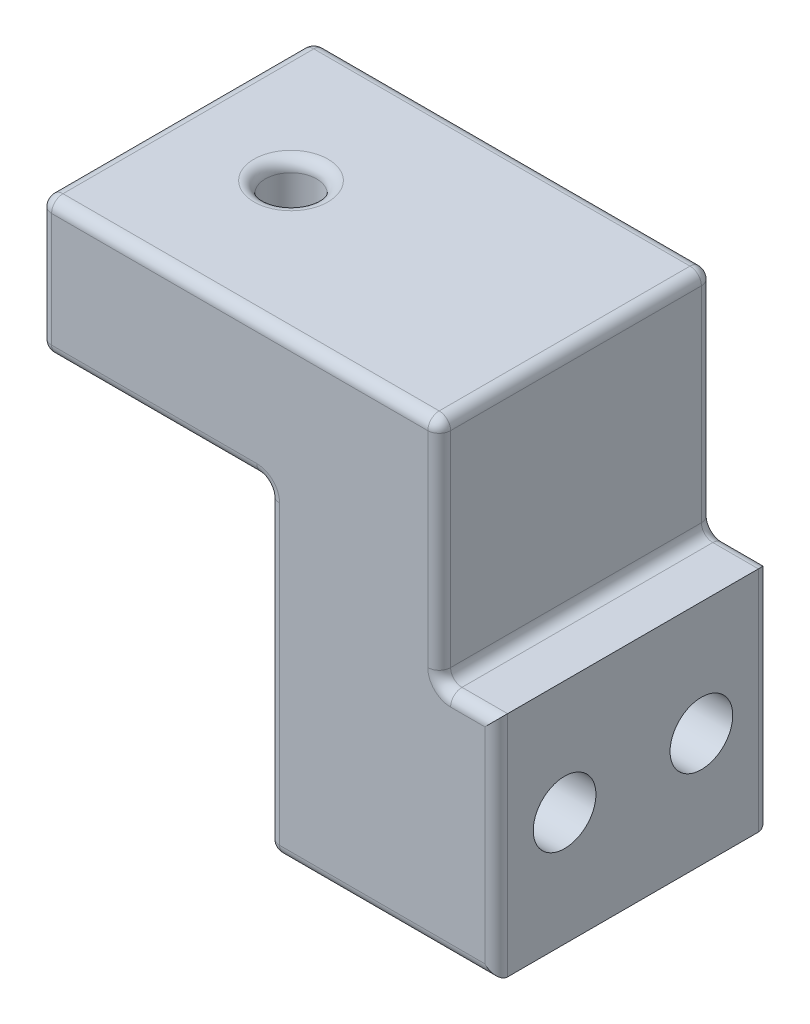
from build123d import *

# Parameters (mm, degrees)
SKETCH4_W           = 40
SKETCH4_H           = 24
BOSS_EXTRUDE2_DEPTH = 40
SKETCH6_W           = 5
SKETCH6_H           = 20
SKETCH6_W_2         = 20
SKETCH6_H_2         = 28
CUT_EXTRUDE1_DEPTH  = 62.449165983
SKETCH7_R           = 2.25
CUT_EXTRUDE2_DEPTH  = 55.405882035
SKETCH10_R          = 2.75
CUT_EXTRUDE4_DEPTH  = 51.754310162
SKETCH12_R          = 4.5
CUT_EXTRUDE5_DEPTH  = 8
FILLET1_R           = 1
CUT_EXTRUDE7_DEPTH  = 5


with BuildPart() as part:
    # Sketch4 → Boss-Extrude2 (new body)
    with BuildSketch(Plane(origin=(0, 0, 0), x_dir=(1, 0, 0), z_dir=(0, 1, 0))):
        with Locations((20, 12)):
            Rectangle(SKETCH4_W, SKETCH4_H)
    extrude(amount=BOSS_EXTRUDE2_DEPTH)

    # Sketch6 → Cut-Extrude1 (cut, through all)
    with BuildSketch(Plane.XY):
        with Locations((37.5, 30)):
            Rectangle(SKETCH6_W, SKETCH6_H)
        with Locations((10, 14)):
            Rectangle(SKETCH6_W_2, SKETCH6_H_2)
    extrude(amount=-CUT_EXTRUDE1_DEPTH, mode=Mode.SUBTRACT)

    # Sketch7 → Cut-Extrude2 (cut, through all)
    with BuildSketch(Plane(origin=(0, 28, 0), x_dir=(-1, 0, 0), z_dir=(0, -1, 0))):
        with Locations(Location((-10, 12, 0), (0, 0, 90))):
            Circle(SKETCH7_R)
    extrude(amount=-CUT_EXTRUDE2_DEPTH, mode=Mode.SUBTRACT)

    # Sketch10 → Cut-Extrude4 (cut, through all)
    with BuildSketch(Plane.ZY.offset(-20)):
        with Locations((-18, 10)):
            Circle(SKETCH10_R)
        with Locations((-6, 10)):
            Circle(SKETCH10_R)
    extrude(amount=-CUT_EXTRUDE4_DEPTH, mode=Mode.SUBTRACT)

    # Sketch12 → Cut-Extrude5 (cut)
    with BuildSketch(Plane.ZY.offset(-20)):
        with Locations((-18, 10)):
            Circle(SKETCH12_R)
        with Locations((-6, 10)):
            Circle(SKETCH12_R)
    extrude(amount=-CUT_EXTRUDE5_DEPTH, mode=Mode.SUBTRACT)

    # Fillet1
    # the kernel refuses this fillet: 1 mm, written as the material it adds along each edge
    with BuildSketch(Plane(origin=(35, 20, 0), x_dir=(1, 0, 0), z_dir=(0, 0, -1)), Plane(origin=(20, 28, 0), x_dir=(-1, 0, 0), z_dir=(0, 0, -1))) as fillet1_piece_1:
        with BuildLine():
            CenterArc((FILLET1_R, -FILLET1_R), FILLET1_R, 90, 90)
            Line((0, -FILLET1_R), (0, 0))
            Line((0, 0), (FILLET1_R, 0))
        make_face()
    extrude(amount=24)
    # the kernel refuses this fillet: 1 mm, written as the material it takes off along each edge
    with BuildSketch(Plane(origin=(21, 1, -1), x_dir=(-1, 0, 0), z_dir=(0, 0, 1))) as fillet1_2_piece_1_section:
        Polygon((0, 0), (FILLET1_R, 0), (FILLET1_R, FILLET1_R), (0, FILLET1_R), align=None)
    fillet1_2_piece_1 = extrude(amount=FILLET1_R, mode=Mode.PRIVATE)
    fillet1_2_piece_1 = fillet1_2_piece_1 - Plane(origin=(21, 1, -1), x_dir=(0.7071067811865475, 0.7071067811865475, 0), z_dir=(0, 0, 1)) * Sphere(FILLET1_R, mode=Mode.PRIVATE)
    add(fillet1_2_piece_1, mode=Mode.SUBTRACT)
    with BuildSketch(Plane(origin=(34, 39, -23), x_dir=(1, 0, 0), z_dir=(0, 0, -1))) as fillet1_2_piece_2_section:
        Polygon((0, 0), (FILLET1_R, 0), (FILLET1_R, -FILLET1_R), (0, -FILLET1_R), align=None)
    fillet1_2_piece_2 = extrude(amount=FILLET1_R, mode=Mode.PRIVATE)
    fillet1_2_piece_2 = fillet1_2_piece_2 - Plane(origin=(34, 39, -23), x_dir=(-0.7071067811865474, -0.7071067811865477, 0), z_dir=(0, 0, -1)) * Sphere(FILLET1_R, mode=Mode.PRIVATE)
    add(fillet1_2_piece_2, mode=Mode.SUBTRACT)
    with BuildSketch(Plane(origin=(1, 39, -23), x_dir=(0, 0, -1), z_dir=(-1, 0, 0))) as fillet1_2_piece_3_section:
        Polygon((0, 0), (FILLET1_R, 0), (FILLET1_R, -FILLET1_R), (0, -FILLET1_R), align=None)
    fillet1_2_piece_3 = extrude(amount=FILLET1_R, mode=Mode.PRIVATE)
    fillet1_2_piece_3 = fillet1_2_piece_3 - Plane(origin=(1, 39, -23), x_dir=(0, -0.7071067811865475, 0.7071067811865475), z_dir=(-1, 0, 0)) * Sphere(FILLET1_R, mode=Mode.PRIVATE)
    add(fillet1_2_piece_3, mode=Mode.SUBTRACT)
    with BuildSketch(Plane(origin=(34, 39, -1), x_dir=(1, 0, 0), z_dir=(0, 0, 1))) as fillet1_2_piece_4_section:
        Polygon((0, 0), (FILLET1_R, 0), (FILLET1_R, FILLET1_R), (0, FILLET1_R), align=None)
    fillet1_2_piece_4 = extrude(amount=FILLET1_R, mode=Mode.PRIVATE)
    fillet1_2_piece_4 = fillet1_2_piece_4 - Plane(origin=(34, 39, -1), x_dir=(-0.7071067811865474, -0.7071067811865477, 0), z_dir=(0, 0, 1)) * Sphere(FILLET1_R, mode=Mode.PRIVATE)
    add(fillet1_2_piece_4, mode=Mode.SUBTRACT)
    with BuildSketch(Plane(origin=(21, 1, -23), x_dir=(-1, 0, 0), z_dir=(0, -1, 0))) as fillet1_2_piece_5_section:
        Polygon((0, 0), (FILLET1_R, 0), (FILLET1_R, FILLET1_R), (0, FILLET1_R), align=None)
    fillet1_2_piece_5 = extrude(amount=FILLET1_R, mode=Mode.PRIVATE)
    fillet1_2_piece_5 = fillet1_2_piece_5 - Plane(origin=(21, 1, -23), x_dir=(0.7071067811865475, 0, 0.7071067811865475), z_dir=(0, -1, 0)) * Sphere(FILLET1_R, mode=Mode.PRIVATE)
    add(fillet1_2_piece_5, mode=Mode.SUBTRACT)
    with BuildSketch(Plane(origin=(1, 29, -23), x_dir=(0, -1, 0), z_dir=(-1, 0, 0))) as fillet1_2_piece_6_section:
        Polygon((0, 0), (FILLET1_R, 0), (FILLET1_R, -FILLET1_R), (0, -FILLET1_R), align=None)
    fillet1_2_piece_6 = extrude(amount=FILLET1_R, mode=Mode.PRIVATE)
    fillet1_2_piece_6 = fillet1_2_piece_6 - Plane(origin=(1, 29, -23), x_dir=(0, 0.7071067811865475, 0.7071067811865475), z_dir=(-1, 0, 0)) * Sphere(FILLET1_R, mode=Mode.PRIVATE)
    add(fillet1_2_piece_6, mode=Mode.SUBTRACT)
    with BuildSketch(Plane(origin=(1, 29, -1), x_dir=(0, -1, 0), z_dir=(-1, 0, 0))) as fillet1_2_piece_7_section:
        Polygon((0, 0), (FILLET1_R, 0), (FILLET1_R, FILLET1_R), (0, FILLET1_R), align=None)
    fillet1_2_piece_7 = extrude(amount=FILLET1_R, mode=Mode.PRIVATE)
    fillet1_2_piece_7 = fillet1_2_piece_7 - Plane(origin=(1, 29, -1), x_dir=(0, 0.7071067811865475, -0.7071067811865475), z_dir=(-1, 0, 0)) * Sphere(FILLET1_R, mode=Mode.PRIVATE)
    add(fillet1_2_piece_7, mode=Mode.SUBTRACT)
    with BuildSketch(Plane(origin=(1, 39, -1), x_dir=(0, 0, 1), z_dir=(-1, 0, 0))) as fillet1_2_piece_8_section:
        Polygon((0, 0), (FILLET1_R, 0), (FILLET1_R, FILLET1_R), (0, FILLET1_R), align=None)
    fillet1_2_piece_8 = extrude(amount=FILLET1_R, mode=Mode.PRIVATE)
    fillet1_2_piece_8 = fillet1_2_piece_8 - Plane(origin=(1, 39, -1), x_dir=(0, -0.7071067811865475, -0.7071067811865475), z_dir=(-1, 0, 0)) * Sphere(FILLET1_R, mode=Mode.PRIVATE)
    add(fillet1_2_piece_8, mode=Mode.SUBTRACT)
    with BuildSketch(Plane(origin=(21, 0, 0), x_dir=(0, 1, 0), z_dir=(1, 0, 0))) as fillet1_2_piece_9:
        with BuildLine():
            CenterArc((FILLET1_R, -FILLET1_R), FILLET1_R, 90, 90)
            Line((0, -FILLET1_R), (0, 0))
            Line((0, 0), (FILLET1_R, 0))
        make_face()
    extrude(amount=21.5, mode=Mode.SUBTRACT)
    with BuildSketch(Plane(origin=(34, 40, -24), x_dir=(0, 0, 1), z_dir=(-1, 0, 0))) as fillet1_2_piece_10:
        with BuildLine():
            CenterArc((FILLET1_R, -FILLET1_R), FILLET1_R, 90, 90)
            Line((0, -FILLET1_R), (0, 0))
            Line((0, 0), (FILLET1_R, 0))
        make_face()
    extrude(amount=33, mode=Mode.SUBTRACT)
    with BuildSketch(Plane(origin=(40, -2.5, -24), x_dir=(0, 0, 1), z_dir=(0, 1, 0)), Plane(origin=(40, -2.5, 0), x_dir=(-1, 0, 0), z_dir=(0, 1, 0))) as fillet1_2_piece_11:
        with BuildLine():
            CenterArc((FILLET1_R, -FILLET1_R), FILLET1_R, 90, 90)
            Line((0, -FILLET1_R), (0, 0))
            Line((0, 0), (FILLET1_R, 0))
        make_face()
    extrude(amount=25, mode=Mode.SUBTRACT)
    with BuildSketch(Plane(origin=(35, 39, -24), x_dir=(0, 0, 1), z_dir=(0, -1, 0)), Plane(origin=(35, 39, 0), x_dir=(-1, 0, 0), z_dir=(0, -1, 0)), Plane(origin=(19, 28, -24), x_dir=(0, 0, 1), z_dir=(-1, 0, 0)), Plane(origin=(19, 28, 0), x_dir=(0, 1, 0), z_dir=(-1, 0, 0))) as fillet1_2_piece_12:
        with BuildLine():
            CenterArc((FILLET1_R, FILLET1_R), FILLET1_R, 180, 90)
            Line((0, FILLET1_R), (0, 0))
            Line((0, 0), (FILLET1_R, 0))
        make_face()
    extrude(amount=18, mode=Mode.SUBTRACT)
    with BuildSketch(Plane(origin=(35, 40, -1), x_dir=(0, -1, 0), z_dir=(0, 0, -1)), Plane(origin=(20, 0, -1), x_dir=(0, 1, 0), z_dir=(0, 0, -1))) as fillet1_2_piece_13:
        with BuildLine():
            CenterArc((FILLET1_R, FILLET1_R), FILLET1_R, 180, 90)
            Line((0, FILLET1_R), (0, 0))
            Line((0, 0), (FILLET1_R, 0))
        make_face()
    extrude(amount=22, mode=Mode.SUBTRACT)
    with BuildSketch(Plane(origin=(36, 20, -24), x_dir=(0, 0, 1), z_dir=(1, 0, 0)), Plane(origin=(36, 20, 0), x_dir=(0, -1, 0), z_dir=(1, 0, 0))) as fillet1_2_piece_14:
        with BuildLine():
            CenterArc((FILLET1_R, FILLET1_R), FILLET1_R, 180, 90)
            Line((0, FILLET1_R), (0, 0))
            Line((0, 0), (FILLET1_R, 0))
        make_face()
    extrude(amount=6.5, mode=Mode.SUBTRACT)
    with BuildSketch(Plane(origin=(20, 1, -24), x_dir=(0, 0, 1), z_dir=(0, 1, 0)), Plane(origin=(20, 1, 0), x_dir=(1, 0, 0), z_dir=(0, 1, 0))) as fillet1_2_piece_15:
        with BuildLine():
            CenterArc((FILLET1_R, FILLET1_R), FILLET1_R, 180, 90)
            Line((0, FILLET1_R), (0, 0))
            Line((0, 0), (FILLET1_R, 0))
        make_face()
    extrude(amount=26, mode=Mode.SUBTRACT)
    with BuildSketch(Plane(origin=(0, 28, -1), x_dir=(1, 0, 0), z_dir=(0, 0, -1)), Plane(origin=(0, 40, -23), x_dir=(1, 0, 0), z_dir=(0, 0, 1))) as fillet1_2_piece_16:
        with BuildLine():
            CenterArc((FILLET1_R, -FILLET1_R), FILLET1_R, 90, 90)
            Line((0, -FILLET1_R), (0, 0))
            Line((0, 0), (FILLET1_R, 0))
        make_face()
    extrude(amount=22, mode=Mode.SUBTRACT)
    with BuildSketch(Plane(origin=(10, 40, -12), x_dir=(0, 0, -1), z_dir=(-1, 0, 0))) as fillet1_2_piece_17:
        with BuildLine():
            CenterArc((2.25 + FILLET1_R, FILLET1_R), FILLET1_R, 180, 90)
            Line((2.25, FILLET1_R), (2.25, 0))
            Line((2.25, 0), (2.25 + FILLET1_R, 0))
        make_face()
    revolve(axis=Axis((10, 40, -12), (0, -1, 0)), mode=Mode.SUBTRACT)
    with BuildSketch(Plane(origin=(42.5, 0, -24), x_dir=(0, 0, 1), z_dir=(-1, 0, 0))) as fillet1_2_piece_18:
        with BuildLine():
            CenterArc((FILLET1_R, FILLET1_R), FILLET1_R, 180, 90)
            Line((0, FILLET1_R), (0, 0))
            Line((0, 0), (FILLET1_R, 0))
        make_face()
    extrude(amount=21.5, mode=Mode.SUBTRACT)
    with BuildSketch(Plane(origin=(20, 10, -18), x_dir=(0, 0, 1), z_dir=(0, -1, 0))) as fillet1_2_piece_19:
        with BuildLine():
            CenterArc((4.5 + FILLET1_R, -FILLET1_R), FILLET1_R, 90, 90)
            Line((4.5, -FILLET1_R), (4.5, 0))
            Line((4.5, 0), (4.5 + FILLET1_R, 0))
        make_face()
    revolve(axis=Axis((20, 10, -18), (-1, 0, 0)), mode=Mode.SUBTRACT)
    with BuildSketch(Plane(origin=(20, 10, -6), x_dir=(0, 0, 1), z_dir=(0, -1, 0))) as fillet1_2_piece_20:
        with BuildLine():
            CenterArc((4.5 + FILLET1_R, -FILLET1_R), FILLET1_R, 90, 90)
            Line((4.5, -FILLET1_R), (4.5, 0))
            Line((4.5, 0), (4.5 + FILLET1_R, 0))
        make_face()
    revolve(axis=Axis((20, 10, -6), (-1, 0, 0)), mode=Mode.SUBTRACT)
    with BuildSketch(Plane(origin=(0, 29, -24), x_dir=(0, 0, 1), z_dir=(0, 1, 0)), Plane(origin=(0, 29, 0), x_dir=(1, 0, 0), z_dir=(0, 1, 0))) as fillet1_2_piece_21:
        with BuildLine():
            CenterArc((FILLET1_R, FILLET1_R), FILLET1_R, 180, 90)
            Line((0, FILLET1_R), (0, 0))
            Line((0, 0), (FILLET1_R, 0))
        make_face()
    extrude(amount=10, mode=Mode.SUBTRACT)
    with BuildSketch(Plane(origin=(1, 40, 0), x_dir=(0, -1, 0), z_dir=(1, 0, 0))) as fillet1_2_piece_22:
        with BuildLine():
            CenterArc((FILLET1_R, FILLET1_R), FILLET1_R, 180, 90)
            Line((0, FILLET1_R), (0, 0))
            Line((0, 0), (FILLET1_R, 0))
        make_face()
    extrude(amount=33, mode=Mode.SUBTRACT)
    with BuildSketch(Plane(origin=(19, 27, 0), x_dir=(0, 1, 0), z_dir=(-1, 0, 0))) as fillet1_2_piece_23:
        with BuildLine():
            CenterArc((1 + FILLET1_R, FILLET1_R), FILLET1_R, 180, 90)
            Line((1, FILLET1_R), (1, 0))
            Line((1, 0), (1 + FILLET1_R, 0))
        make_face()
    revolve(axis=Axis((19, 27, 0), (0, 0, -1)), revolution_arc=90, mode=Mode.SUBTRACT)
    with BuildSketch(Plane(origin=(19, 27, -24), x_dir=(0, 1, 0), z_dir=(-1, 0, 0))) as fillet1_2_piece_24:
        with BuildLine():
            CenterArc((1 + FILLET1_R, -FILLET1_R), FILLET1_R, 90, 90)
            Line((1 + FILLET1_R, 0), (1, 0))
            Line((1, 0), (1, -FILLET1_R))
        make_face()
    revolve(axis=Axis((19, 27, -24), (0, 0, -1)), revolution_arc=90, mode=Mode.SUBTRACT)
    with BuildSketch(Plane(origin=(36, 21, 0), x_dir=(0, -1, 0), z_dir=(1, 0, 0))) as fillet1_2_piece_25:
        with BuildLine():
            CenterArc((1 + FILLET1_R, FILLET1_R), FILLET1_R, 180, 90)
            Line((1, FILLET1_R), (1, 0))
            Line((1, 0), (1 + FILLET1_R, 0))
        make_face()
    revolve(axis=Axis((36, 21, 0), (0, 0, -1)), revolution_arc=90, mode=Mode.SUBTRACT)
    with BuildSketch(Plane(origin=(36, 21, -24), x_dir=(0, -1, 0), z_dir=(1, 0, 0))) as fillet1_2_piece_26:
        with BuildLine():
            CenterArc((1 + FILLET1_R, -FILLET1_R), FILLET1_R, 90, 90)
            Line((1, -FILLET1_R), (1, 0))
            Line((1, 0), (1 + FILLET1_R, 0))
        make_face()
    revolve(axis=Axis((36, 21, -24), (0, 0, -1)), revolution_arc=90, mode=Mode.SUBTRACT)

    # Sketch14 → Cut-Extrude7 (cut)
    with BuildSketch(Plane.XZ.offset(-28)):
        Polygon((6.5, -14.020725942), (10, -16.041451884), (13.5, -14.020725942), (13.5, -9.979274058), (10, -7.958548116), (6.5, -9.979274058), align=None)
    extrude(amount=-CUT_EXTRUDE7_DEPTH, mode=Mode.SUBTRACT)


solid = part.part
